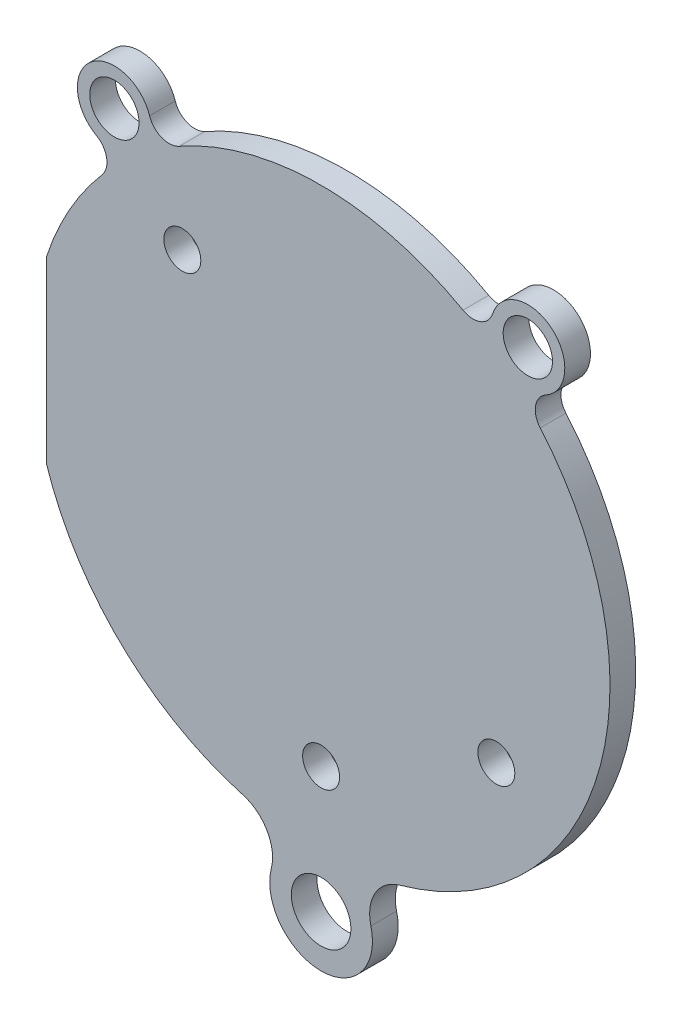
from build123d import *

# Parameters (mm, degrees)
SKETCH1_R           = 1.8415
SKETCH1_R_2         = 1.524
BOSS_EXTRUDE1_DEPTH = 1.5875
SKETCH2_R           = 1.143
CUT_EXTRUDE1_DEPTH  = 31.126747514


with BuildPart() as part:
    # Sketch1 → Boss-Extrude1 (new body)
    with BuildSketch(Plane.XY):
        with BuildLine():
            Line((-16.984058744, -5.5245), (-16.984058744, 5.5245))
            ThreePointArc((-16.984058744, 5.5245), (-15.568317368, 8.752476564), (-13.546192494, 11.63954555))
            ThreePointArc((-13.546192494, 11.63954555), (-13.259158261, 12.690113591), (-13.891550513, 13.576771304))
            ThreePointArc((-13.891550513, 13.576771304), (-14.229434947, 17.341171737), (-10.60343846, 16.274857526))
            ThreePointArc((-10.60343846, 16.274857526), (-9.857305878, 15.481530337), (-8.770915553, 15.557936625))
            ThreePointArc((-8.770915553, 15.557936625), (0, 17.859965052), (8.770915553, 15.557936625))
            ThreePointArc((8.770915553, 15.557936625), (9.857305878, 15.481530337), (10.60343846, 16.274857526))
            ThreePointArc((10.60343846, 16.274857526), (14.229434947, 17.341171737), (13.891550513, 13.576771304))
            ThreePointArc((13.891550513, 13.576771304), (13.259158261, 12.690113591), (13.546192494, 11.63954555))
            ThreePointArc((13.546192494, 11.63954555), (17.099028169, -5.157672667), (4.850582957, -17.188664772))
            ThreePointArc((4.850582957, -17.188664772), (3.34119056, -18.362373067), (3.078011585, -20.256203417))
            ThreePointArc((3.078011585, -20.256203417), (0, -24.209965052), (-3.078011585, -20.256203417))
            ThreePointArc((-3.078011585, -20.256203417), (-3.34119056, -18.362373067), (-4.850582957, -17.188664772))
            ThreePointArc((-4.850582957, -17.188664772), (-12.377442365, -12.875452309), (-16.984058744, -5.5245))
        make_face()
        with Locations((0, -21.034965052)):
            Circle(SKETCH1_R, mode=Mode.SUBTRACT)
        with Locations((-12.779339593, 15.573965052)):
            Circle(SKETCH1_R_2, mode=Mode.SUBTRACT)
        with Locations((12.779339593, 15.573965052)):
            Circle(SKETCH1_R_2, mode=Mode.SUBTRACT)
    extrude(amount=BOSS_EXTRUDE1_DEPTH)

    # Sketch2 → Cut-Extrude1 (cut, through all)
    with BuildSketch(Plane.XY.offset(1.5875)):
        with Locations((-8.579035657, 10.1092)):
            Circle(SKETCH2_R)
        with Locations((10.832526773, -7.6454)):
            Circle(SKETCH2_R)
        with Locations((0, -13.2588)):
            Circle(SKETCH2_R)
    extrude(amount=-CUT_EXTRUDE1_DEPTH, mode=Mode.SUBTRACT)


solid = part.part
